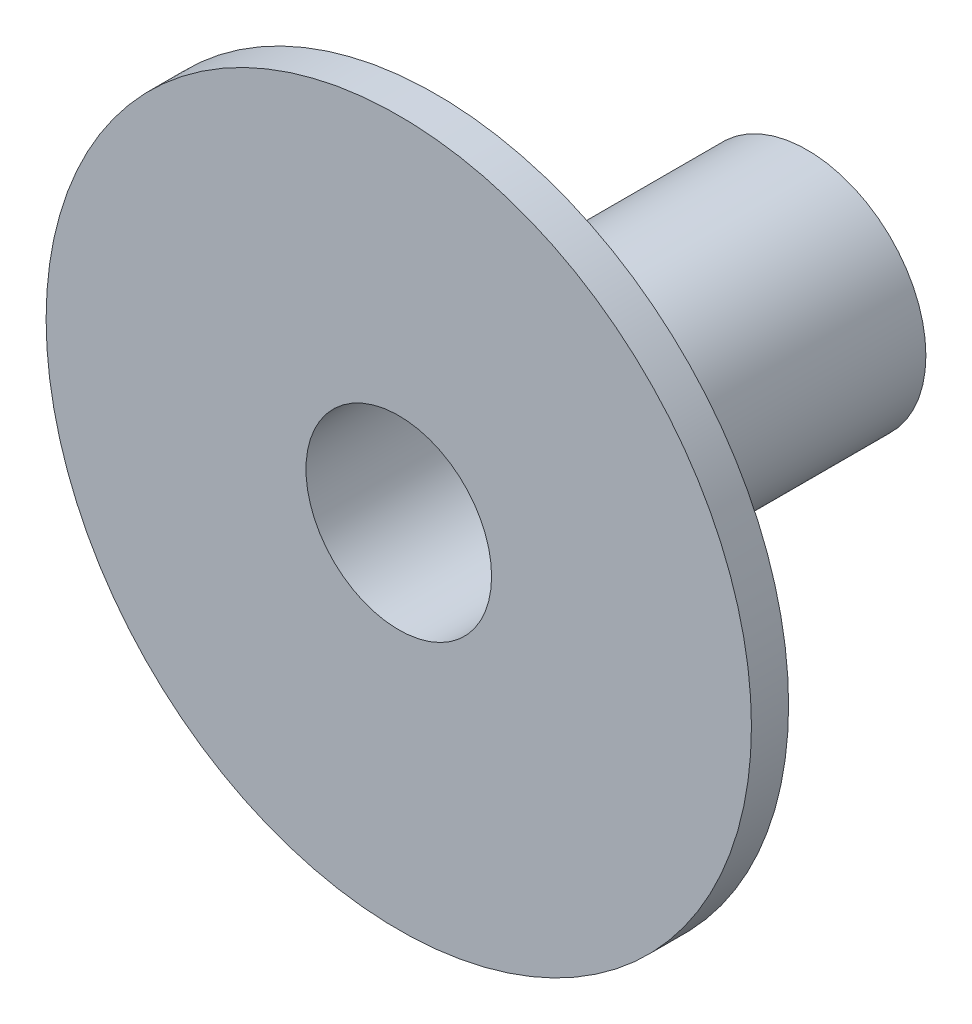
from build123d import *
from build123d.topology import SkipClean

# Parameters (mm, degrees)
SKETCH3_R           = 2.50000008
CUT_EXTRUDE1_DEPTH  = 2.54
SKETCH4_R           = 3.19786
SKETCH4_R_2         = 2.50000008
BOSS_EXTRUDE1_DEPTH = 9.99998


with BuildPart() as part:
    # Sketch2 → Revolve1 (revolve)
    with BuildSketch(Plane(origin=(0, 0, 0), x_dir=(0, 0, -1), z_dir=(1, 0, 0))):
        Polygon((0, 2.4995886), (0, 0), (1.00076, 0), (1.00076, 9.4996), (0, 9.4996), align=None)
    revolve(axis=Axis((0, 0, -1.00076), (0, 0, 1)))

    # Sketch3 → Cut-Extrude1 (cut)
    with BuildSketch(Plane.XY):
        Circle(SKETCH3_R)
    extrude(amount=-CUT_EXTRUDE1_DEPTH, mode=Mode.SUBTRACT)

    # Sketch4 → Boss-Extrude1 (add)
    with SkipClean():  # the faces are left unmerged after this step: merging them gives an invalid solid
        with BuildSketch(Plane(origin=(0, 0, -1.00076), x_dir=(-1, 0, 0), z_dir=(0, 0, -1))):
            Circle(SKETCH4_R)
            Circle(SKETCH4_R_2, mode=Mode.SUBTRACT)
        extrude(amount=BOSS_EXTRUDE1_DEPTH)


solid = part.part
